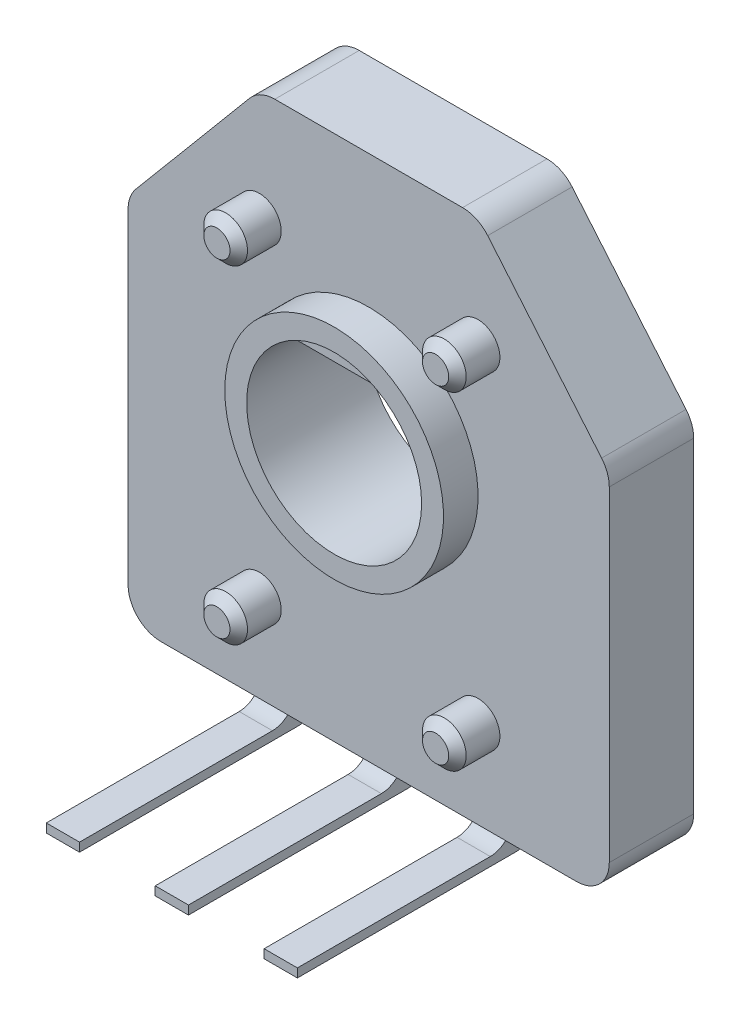
from build123d import *
from build123d.topology import SkipClean

# Parameters (mm, degrees)
BOSS_EXTRUDE1_DEPTH      = 1.93
SKETCH2_R                = 2.5
SKETCH2_R_2              = 2
BOSS_EXTRUDE2_DEPTH      = 0.79
BOSS_EXTRUDE3_DEPTH      = 4.5
BOSS_EXTRUDE3_DEPTH_BACK = 1
SKETCH3_W                = 0.76
SKETCH3_H                = 0.6
FILLET2_R                = 0.75
SKETCH4_W                = 5.74
SKETCH4_H                = 0.4
CUT_EXTRUDE1_DEPTH       = 4.9
FILLET1_R                = 0.5
SKETCH5_R                = 0.5
BOSS_EXTRUDE4_DEPTH      = 0.97
CHAMFER1_SIZE            = 0.2


with BuildPart() as part:
    # Sketch1 → Boss-Extrude1 (new body)
    with BuildSketch(Plane.XY):
        Polygon((5.5, 0), (5.5, -6.5), (-5.5, -6.5), (-5.5, 0), (-5.5, 1.96), (-2.49602332, 5.54), (2.49602332, 5.54), (5.5, 1.96), align=None)
        with BuildLine():
            Line((-1.718566554, 1.023), (1.718566554, 1.023))
            ThreePointArc((1.718566554, 1.023), (0, -2), (-1.718566554, 1.023))
        make_face(mode=Mode.SUBTRACT)
    extrude(amount=BOSS_EXTRUDE1_DEPTH)

    # Sketch2 → Boss-Extrude2 (add)
    with SkipClean():  # the faces are left unmerged after this step: merging them gives an invalid solid
        with BuildSketch(Plane.XY.offset(1.93)):
            with Locations(Location((0, 0, 0), (0, 0, 180))):
                Circle(SKETCH2_R)
            with Locations(Location((0, 0, 0), (0, 0, 149.236204264))):
                Circle(SKETCH2_R_2, mode=Mode.SUBTRACT)
        extrude(amount=BOSS_EXTRUDE2_DEPTH)

    # Sketch3 → Boss-Extrude3 (add, two sides: drawn at the far end of the back side and taken through both)
    with SkipClean():  # the faces are left unmerged after this step: merging them gives an invalid solid
        with BuildSketch(Plane.XY.offset(1.93).offset(-BOSS_EXTRUDE3_DEPTH_BACK)):
            with Locations((0, -6.8)):
                Rectangle(SKETCH3_W, SKETCH3_H)
            with Locations((2.49, -6.8)):
                Rectangle(SKETCH3_W, SKETCH3_H)
            with Locations((-2.49, -6.8)):
                Rectangle(SKETCH3_W, SKETCH3_H)
        extrude(amount=BOSS_EXTRUDE3_DEPTH + BOSS_EXTRUDE3_DEPTH_BACK)

    # Fillet2
    fillet2_edges = [part.edges().sort_by_distance(p)[0] for p in [
        (5.5, -6.5, 0.965),
        (-5.5, -6.5, 0.965),
        (-5.5, 1.96, 0.965),
        (-2.49602332, 5.54, 0.965),
        (2.49602332, 5.54, 0.965),
        (5.5, 1.96, 0.965),
    ]]
    fillet(fillet2_edges, radius=FILLET2_R)

    # Sketch4 → Cut-Extrude1 (cut)
    with SkipClean():  # the faces are left unmerged after this step: merging them gives an invalid solid
        with BuildSketch(Plane.XY.offset(6.43)):
            with Locations((0, -6.7)):
                Rectangle(SKETCH4_W, SKETCH4_H)
        extrude(amount=-CUT_EXTRUDE1_DEPTH, mode=Mode.SUBTRACT)

    # Fillet1
    # the kernel refuses this fillet: 0.5 mm, written as the material it adds along each edge
    with BuildSketch(Plane(origin=(2.87, -6.9, 1.53), x_dir=(0, 1.0, 1.5715206913564052e-12), z_dir=(-1, 0, 0)), Plane(origin=(0.38, -6.9, 1.53), x_dir=(0, 1.0, 1.5715206913564052e-12), z_dir=(-1, 0, 0)), Plane(origin=(-2.11, -6.9, 1.53), x_dir=(0, 1.0, 1.5715206913564052e-12), z_dir=(-1, 0, 0))) as fillet1_piece_1:
        with BuildLine():
            CenterArc((0.5, -0.489897949), FILLET1_R, 101.536959033, 78.463040967)
            Line((0, -0.489897949), (0, 0))
            Line((0, 0), (0.4, 0))
        make_face()
    extrude(amount=0.76)
    # the kernel refuses this fillet: 0.5 mm, written as the material it takes off along each edge
    with BuildSketch(Plane(origin=(0.86, -7.1, 0.93), x_dir=(0, 1, 0), z_dir=(1, 0, 0)), Plane(origin=(-4.12, -7.1, 0.93), x_dir=(0, 1, 0), z_dir=(1, 0, 0))) as fillet1_2_piece_1:
        with BuildLine():
            CenterArc((FILLET1_R, FILLET1_R), FILLET1_R, 180, 90)
            Line((0, FILLET1_R), (0, 0))
            Line((0, 0), (FILLET1_R, 0))
        make_face()
    extrude(amount=3.26, mode=Mode.SUBTRACT)
    with BuildSketch(Plane(origin=(1.63, -7.1, 0.93), x_dir=(0, 1, 0), z_dir=(-1, 0, 0))) as fillet1_2_piece_2:
        with BuildLine():
            CenterArc((FILLET1_R, -FILLET1_R), FILLET1_R, 90, 90)
            Line((0, -FILLET1_R), (0, 0))
            Line((0, 0), (FILLET1_R, 0))
        make_face()
    extrude(amount=3.26, mode=Mode.SUBTRACT)

    # Sketch5 → Boss-Extrude4 (add)
    with BuildSketch(Plane.XY.offset(1.93)):
        with Locations(Location((-2.5, -4.5, 0), (0, 0, 180))):
            Circle(SKETCH5_R)
        with Locations(Location((2.5, -4.5, 0), (0, 0, 180))):
            Circle(SKETCH5_R)
        with Locations(Location((2.5, 3, 0), (0, 0, 180))):
            Circle(SKETCH5_R)
        with Locations(Location((-2.5, 3, 0), (0, 0, 180))):
            Circle(SKETCH5_R)
    extrude(amount=BOSS_EXTRUDE4_DEPTH)

    # Chamfer1
    chamfer1_edges = [part.edges().sort_by_distance(p)[0] for p in [
        (3, -4.5, 2.9),
        (-2, -4.5, 2.9),
        (3, 3, 2.9),
        (-2, 3, 2.9),
    ]]
    chamfer(chamfer1_edges, length=CHAMFER1_SIZE)


solid = part.part
